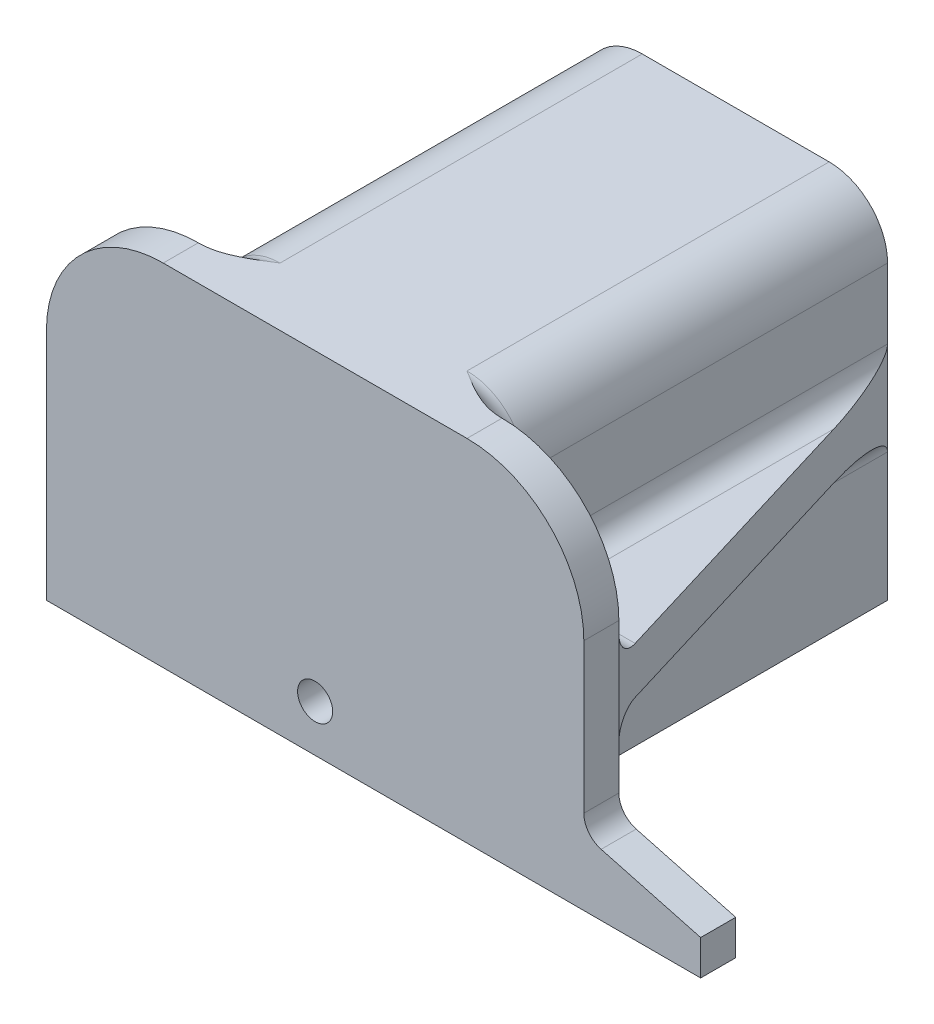
from build123d import *

# Parameters (mm, degrees)
BOSS_EXTRUDE1_DEPTH = 15
BOSS_EXTRUDE2_DEPTH = 2
SKETCH3_R           = 1.5
CUT_EXTRUDE1_DEPTH  = 41.669398815
FILLET1_R           = 10
CUT_EXTRUDE4_DEPTH  = 2
FILLET2_R           = 0.5
SKETCH5_W           = 20
SKETCH5_H           = 3
BOSS_EXTRUDE3_DEPTH = 30
SKETCH6_W           = 3
SKETCH6_H           = 3
BOSS_EXTRUDE4_DEPTH = 10
CHAMFER1_SIZE2      = 10
CHAMFER1_SIZE       = 2.679491924
FILLET3_R           = 5
FILLET4_R           = 2


# Some blends are built 0.0001 mm under size
with BuildPart() as part:
    # Sketch1 → Boss-Extrude1 (new, symmetric)
    with BuildSketch(Plane(origin=(0, 0, 0), x_dir=(1, 0, 0), z_dir=(0, 1, 0))):
        Polygon((10, 0), (-10, 0), (-10, 30), (-13, 30), (-13, -3), (-23, -3), (-23, -6), (23, -6), (23, -3), (13, -3), (13, 30), (10, 30), align=None)
    extrude(amount=BOSS_EXTRUDE1_DEPTH, both=True)

    # Sketch2 → Boss-Extrude2 (add, symmetric)
    with BuildSketch(Plane(origin=(0, 0, 0), x_dir=(1, 0, 0), z_dir=(0, 1, 0))):
        Polygon((13, 30), (13, -3), (23, -3), align=None)
    boss_extrude2 = extrude(amount=BOSS_EXTRUDE2_DEPTH, both=True)

    # Mirror1: Boss-Extrude2 across plane
    add(boss_extrude2.mirror(Plane(origin=(0, 0, 0), x_dir=(0, 0, 1), z_dir=(1, 0, 0))))

    # Sketch3 → Cut-Extrude1 (cut, through all)
    with BuildSketch(Plane(origin=(0, 0, 0), x_dir=(-1, 0, 0), z_dir=(0, 0, -1))):
        with Locations((0, -11)):
            Circle(SKETCH3_R)
    extrude(amount=-CUT_EXTRUDE1_DEPTH, mode=Mode.SUBTRACT)

    # Fillet1
    fillet1_edges = [part.edges().sort_by_distance(p)[0] for p in [
        (23, 15, 4.5),
        (-23, 15, 4.5),
    ]]
    fillet(fillet1_edges, radius=FILLET1_R)

    # Sketch4 → Cut-Extrude4 (cut)
    with BuildSketch(Plane(origin=(0, 0, 0), x_dir=(-1, 0, 0), z_dir=(0, 0, -1))):
        with BuildLine():
            Line((0, -15), (4, -15))
            Line((4, -15), (4, -11))
            ThreePointArc((4, -11), (0, -7), (-4, -11))
            Line((-4, -11), (-4, -15))
            Line((-4, -15), (0, -15))
        make_face()
    extrude(amount=-CUT_EXTRUDE4_DEPTH, mode=Mode.SUBTRACT)

    # Fillet2
    fillet2_edges = [part.edges().sort_by_distance(p)[0] for p in [
        (4, -13, 2),
        (0, -7, 2),
        (-4, -13, 2),
    ]]
    fillet(fillet2_edges, radius=FILLET2_R)

    # Sketch5 → Boss-Extrude3 (add)
    with BuildSketch(Plane(origin=(0, 0, 0), x_dir=(-1, 0, 0), z_dir=(0, 0, -1))):
        with Locations((0, 13.5)):
            Rectangle(SKETCH5_W, SKETCH5_H)
    extrude(amount=BOSS_EXTRUDE3_DEPTH)

    # Sketch6 → Boss-Extrude4 (add)
    with BuildSketch(Plane(origin=(23, 0, 0), x_dir=(0, 0, -1), z_dir=(1, 0, 0))):
        with Locations((-4.5, -13.5)):
            Rectangle(SKETCH6_W, SKETCH6_H)
    extrude(amount=BOSS_EXTRUDE4_DEPTH)

    # Chamfer1
    chamfer1_edges = [part.edges().sort_by_distance(p)[0] for p in [
        (23, -12, 4.5),
    ]]
    chamfer1_side = [part.faces().sort_by_distance(p)[0] for p in [
        (23, -11.946410162, 4.5),
    ]]
    chamfer(chamfer1_edges, length=CHAMFER1_SIZE - 0.0001, length2=CHAMFER1_SIZE2 - 0.0001, reference=chamfer1_side[0])  # a hair under: the kernel refuses the full size

    # Fillet3
    fillet3_edges = [part.edges().sort_by_distance(p)[0] for p in [
        (10, 12, -15),
        (0, 12, 0),
        (-10, 12, -15),
        (13, 15, -13.5),
        (-13, 15, -13.5),
    ]]
    fillet(fillet3_edges, radius=FILLET3_R)

    # Fillet4
    # the kernel refuses this fillet: 2 mm, written as the material it adds along each edge
    with BuildSketch(Plane(origin=(-15, 4, 1), x_dir=(0, -1, 0), z_dir=(0, 0, 1))) as fillet4_piece_1_section:
        Polygon((0, 0), (FILLET4_R * 1.02, 0), (FILLET4_R * 1.02, FILLET4_R * 1.02), (0, FILLET4_R * 1.02), align=None)
    fillet4_piece_1 = extrude(amount=FILLET4_R * 1.02, mode=Mode.PRIVATE)
    fillet4_piece_1 = fillet4_piece_1 - Plane(origin=(-15, 4, 1), x_dir=(-0.7071067811865475, 0.7071067811865475, 0), z_dir=(0, 0, 1)) * Sphere(FILLET4_R, mode=Mode.PRIVATE)
    add(fillet4_piece_1)
    with BuildSketch(Plane(origin=(15, 4, 1), x_dir=(-1, 0, 0), z_dir=(0, 0, 1))) as fillet4_piece_2_section:
        Polygon((0, 0), (FILLET4_R * 1.02, 0), (FILLET4_R * 1.02, FILLET4_R * 1.02), (0, FILLET4_R * 1.02), align=None)
    fillet4_piece_2 = extrude(amount=FILLET4_R * 1.02, mode=Mode.PRIVATE)
    fillet4_piece_2 = fillet4_piece_2 - Plane(origin=(15, 4, 1), x_dir=(0.7071067811865475, 0.7071067811865475, 0), z_dir=(0, 0, 1)) * Sphere(FILLET4_R, mode=Mode.PRIVATE)
    add(fillet4_piece_2)
    with BuildSketch(Plane(origin=(15, -4, 1), x_dir=(0, 1, 0), z_dir=(-1, 0, 0))) as fillet4_piece_3_section:
        Polygon((0, 0), (FILLET4_R * 1.02, 0), (FILLET4_R * 1.02, -FILLET4_R * 1.02), (0, -FILLET4_R * 1.02), align=None)
    fillet4_piece_3 = extrude(amount=FILLET4_R * 1.02, mode=Mode.PRIVATE)
    fillet4_piece_3 = fillet4_piece_3 - Plane(origin=(15, -4, 1), x_dir=(0, -0.7071067811865475, -0.7071067811865475), z_dir=(-1, 0, 0)) * Sphere(FILLET4_R, mode=Mode.PRIVATE)
    add(fillet4_piece_3)
    with BuildSketch(Plane(origin=(-15, -4, 1), x_dir=(1, 0, 0), z_dir=(0, 0, 1))) as fillet4_piece_4_section:
        Polygon((0, 0), (FILLET4_R * 1.02, 0), (FILLET4_R * 1.02, FILLET4_R * 1.02), (0, FILLET4_R * 1.02), align=None)
    fillet4_piece_4 = extrude(amount=FILLET4_R * 1.02, mode=Mode.PRIVATE)
    fillet4_piece_4 = fillet4_piece_4 - Plane(origin=(-15, -4, 1), x_dir=(-0.7071067811865475, -0.7071067811865475, 0), z_dir=(0, 0, 1)) * Sphere(FILLET4_R, mode=Mode.PRIVATE)
    add(fillet4_piece_4)
    with BuildSketch(Plane(origin=(23, -9.320608076, 3), x_dir=(0, 1, 0), z_dir=(0, 0, 1))) as fillet4_piece_5:
        with BuildLine():
            CenterArc((FILLET4_R * 0.767332413902, -FILLET4_R), FILLET4_R, 90, 75.000391344)
            Line((-FILLET4_R * 0.19859518016, -FILLET4_R * 0.741187552406), (0, 0))
            Line((0, 0), (FILLET4_R * 0.767332413902, 0))
        make_face()
    extrude(amount=3)
    with BuildSketch(Plane(origin=(-13, 4, 3), x_dir=(-1, 0, 0), z_dir=(0, 1, 0))) as fillet4_piece_6:
        with BuildLine():
            CenterArc((FILLET4_R, -FILLET4_R), FILLET4_R, 90, 90)
            Line((0, -FILLET4_R), (0, 0))
            Line((0, 0), (FILLET4_R, 0))
        make_face()
    extrude(amount=6)
    with BuildSketch(Plane(origin=(13, 4, 3), x_dir=(1, 0, 0), z_dir=(0, 1, 0))) as fillet4_piece_7:
        with BuildLine():
            CenterArc((FILLET4_R, FILLET4_R), FILLET4_R, 180, 90)
            Line((0, FILLET4_R), (0, 0))
            Line((0, 0), (FILLET4_R, 0))
        make_face()
    extrude(amount=6)
    with BuildSketch(Plane(origin=(-8, 10, 3), x_dir=(0.8416879607506225, 0.5399642365263265, 0), z_dir=(0.5399642365263265, -0.8416879607506225, 0))) as fillet4_piece_8_section:
        with BuildLine():
            CenterArc((5 + FILLET4_R, -FILLET4_R), FILLET4_R, 90, 90)
            Line((5 + FILLET4_R, 0), (5, 0))
            Line((5, 0), (5, -FILLET4_R))
        make_face()
    fillet4_piece_8 = revolve(axis=Axis((-8, 10, 3), (0, 0, 1)), revolution_arc=147.318795695, mode=Mode.PRIVATE)
    fillet4_piece_8 = split(fillet4_piece_8, bisect_by=Plane(origin=(-11.613068515, 15, 2.473069622), z_dir=(0, -1, 0)), keep=Keep.TOP, mode=Mode.PRIVATE)
    add(fillet4_piece_8)
    with BuildSketch(Plane(origin=(8, 10, 3), x_dir=(-0.8416879607506222, 0.5399642365263269, 0), z_dir=(-0.5399642365263269, -0.8416879607506222, 0))) as fillet4_piece_9_section:
        with BuildLine():
            CenterArc((5 + FILLET4_R, FILLET4_R), FILLET4_R, 180, 90)
            Line((5, FILLET4_R), (5, 0))
            Line((5, 0), (5 + FILLET4_R, 0))
        make_face()
    fillet4_piece_9 = revolve(axis=Axis((8, 10, 3), (0, 0, -1)), revolution_arc=147.318795695, mode=Mode.PRIVATE)
    fillet4_piece_9 = split(fillet4_piece_9, bisect_by=Plane(origin=(11.613076931, 15, 2.472895292), z_dir=(0, -1, 0)), keep=Keep.TOP, mode=Mode.PRIVATE)
    add(fillet4_piece_9)
    with BuildSketch(Plane(origin=(13, -15, 3), x_dir=(1, 0, 0), z_dir=(0, 1, 0)), Plane(origin=(-13, -15, 3), x_dir=(0, 0, -1), z_dir=(0, 1, 0))) as fillet4_piece_10:
        with BuildLine():
            CenterArc((FILLET4_R, FILLET4_R), FILLET4_R, 180, 90)
            Line((0, FILLET4_R), (0, 0))
            Line((0, 0), (FILLET4_R, 0))
        make_face()
    extrude(amount=11)
    with BuildSketch(Plane(origin=(13, -2, -35), x_dir=(0, -1, 0), z_dir=(0, 0, 1))) as fillet4_piece_11_section:
        with BuildLine():
            CenterArc((FILLET4_R, FILLET4_R), FILLET4_R, 180, 90)
            Line((0, FILLET4_R), (0, 0))
            Line((0, 0), (FILLET4_R, 0))
        make_face()
    fillet4_piece_11 = extrude(amount=36, mode=Mode.PRIVATE)
    fillet4_piece_11 = split(fillet4_piece_11, bisect_by=Plane(origin=(17.53556841, -2.455982706, -15.032624248), z_dir=(-0.9570244044334736, 0, 0.29000739528287095)), keep=Keep.TOP, mode=Mode.PRIVATE)
    add(fillet4_piece_11)
    with BuildSketch(Plane(origin=(15, -2, 3), x_dir=(0, -1, 0), z_dir=(1, 0, 0))) as fillet4_piece_12_section:
        with BuildLine():
            CenterArc((FILLET4_R, FILLET4_R), FILLET4_R, 180, 90)
            Line((0, FILLET4_R), (0, 0))
            Line((0, 0), (FILLET4_R, 0))
        make_face()
    fillet4_piece_12 = extrude(amount=13, mode=Mode.PRIVATE)
    fillet4_piece_12 = split(fillet4_piece_12, bisect_by=Plane(origin=(22.535474122, -2.449923656, 1.467064601), z_dir=(-0.9570244044334736, 0, 0.29000739528287095)), keep=Keep.TOP, mode=Mode.PRIVATE)
    add(fillet4_piece_12)
    with BuildSketch(Plane(origin=(13, 2, -35), x_dir=(0, 1, 0), z_dir=(0, 0, 1))) as fillet4_piece_13_section:
        with BuildLine():
            CenterArc((FILLET4_R, -FILLET4_R), FILLET4_R, 90, 90)
            Line((0, -FILLET4_R), (0, 0))
            Line((0, 0), (FILLET4_R, 0))
        make_face()
    fillet4_piece_13 = extrude(amount=36, mode=Mode.PRIVATE)
    fillet4_piece_13 = split(fillet4_piece_13, bisect_by=Plane(origin=(17.53556841, 2.455982706, -15.032624248), z_dir=(-0.9570244044334736, 0, 0.29000739528287095)), keep=Keep.TOP, mode=Mode.PRIVATE)
    add(fillet4_piece_13)
    with BuildSketch(Plane(origin=(15, 2, 3), x_dir=(0, 1, 0), z_dir=(1, 0, 0))) as fillet4_piece_14_section:
        with BuildLine():
            CenterArc((FILLET4_R, -FILLET4_R), FILLET4_R, 90, 90)
            Line((0, -FILLET4_R), (0, 0))
            Line((0, 0), (FILLET4_R, 0))
        make_face()
    fillet4_piece_14 = extrude(amount=13, mode=Mode.PRIVATE)
    fillet4_piece_14 = split(fillet4_piece_14, bisect_by=Plane(origin=(22.535474122, 2.449923656, 1.467064601), z_dir=(-0.9570244044334736, 0, 0.29000739528287095)), keep=Keep.TOP, mode=Mode.PRIVATE)
    add(fillet4_piece_14)
    with BuildSketch(Plane(origin=(-15, 2, 3), x_dir=(0, 1, 0), z_dir=(-1, 0, 0))) as fillet4_piece_15_section:
        with BuildLine():
            CenterArc((FILLET4_R, FILLET4_R), FILLET4_R, 180, 90)
            Line((0, FILLET4_R), (0, 0))
            Line((0, 0), (FILLET4_R, 0))
        make_face()
    fillet4_piece_15 = extrude(amount=13, mode=Mode.PRIVATE)
    fillet4_piece_15 = split(fillet4_piece_15, bisect_by=Plane(origin=(-22.535474122, 2.449923656, 1.467064601), z_dir=(0.9570244044334736, 0, 0.29000739528287095)), keep=Keep.TOP, mode=Mode.PRIVATE)
    add(fillet4_piece_15)
    with BuildSketch(Plane(origin=(-13, 2, -35), x_dir=(0, 1, 0), z_dir=(0, 0, 1))) as fillet4_piece_16_section:
        with BuildLine():
            CenterArc((FILLET4_R, FILLET4_R), FILLET4_R, 180, 90)
            Line((0, FILLET4_R), (0, 0))
            Line((0, 0), (FILLET4_R, 0))
        make_face()
    fillet4_piece_16 = extrude(amount=36, mode=Mode.PRIVATE)
    fillet4_piece_16 = split(fillet4_piece_16, bisect_by=Plane(origin=(-17.53556841, 2.455982706, -15.032624248), z_dir=(0.9570244044334736, 0, 0.29000739528287095)), keep=Keep.TOP, mode=Mode.PRIVATE)
    add(fillet4_piece_16)
    with BuildSketch(Plane(origin=(-13, -2, -35), x_dir=(0, -1, 0), z_dir=(0, 0, 1))) as fillet4_piece_17_section:
        with BuildLine():
            CenterArc((FILLET4_R, -FILLET4_R), FILLET4_R, 90, 90)
            Line((0, -FILLET4_R), (0, 0))
            Line((0, 0), (FILLET4_R, 0))
        make_face()
    fillet4_piece_17 = extrude(amount=36, mode=Mode.PRIVATE)
    fillet4_piece_17 = split(fillet4_piece_17, bisect_by=Plane(origin=(-17.53556841, -2.455982706, -15.032624248), z_dir=(0.9570244044334736, 0, 0.29000739528287095)), keep=Keep.TOP, mode=Mode.PRIVATE)
    add(fillet4_piece_17)
    with BuildSketch(Plane(origin=(-15, -2, 3), x_dir=(0, -1, 0), z_dir=(-1, 0, 0))) as fillet4_piece_18_section:
        with BuildLine():
            CenterArc((FILLET4_R, -FILLET4_R), FILLET4_R, 90, 90)
            Line((0, -FILLET4_R), (0, 0))
            Line((0, 0), (FILLET4_R, 0))
        make_face()
    fillet4_piece_18 = extrude(amount=13, mode=Mode.PRIVATE)
    fillet4_piece_18 = split(fillet4_piece_18, bisect_by=Plane(origin=(-22.535474122, -2.449923656, 1.467064601), z_dir=(0.9570244044334736, 0, 0.29000739528287095)), keep=Keep.TOP, mode=Mode.PRIVATE)
    add(fillet4_piece_18)


solid = part.part
